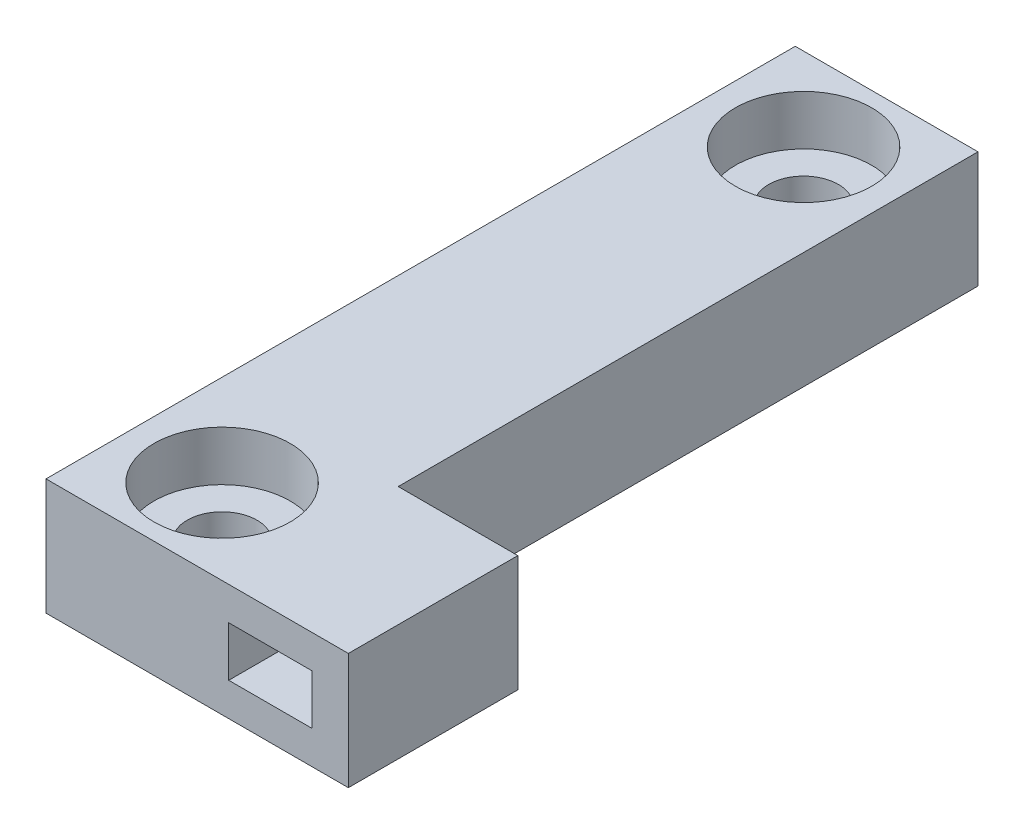
from build123d import *

# Parameters (mm, degrees)
BOSS_EXTRUDE1_DEPTH = 7
CUT_EXTRUDE1_REACH  = 51.135
SKETCH2_W           = 5
SKETCH2_H           = 3
CUT_EXTRUDE2_REACH  = 51.135
SKETCH3_R           = 2.1
SKETCH4_R           = 4.1
CUT_EXTRUDE3_DEPTH  = 3


with BuildPart() as part:
    # Sketch1 → Boss-Extrude1 (new body)
    with BuildSketch(Plane(origin=(0, 0, 0), x_dir=(1, 0, 0), z_dir=(0, 1, 0))):
        Polygon((0, 0), (18.2, 0), (18.2, 10.2), (11, 10.2), (11, 45.1), (0, 45.1), align=None)
    extrude(amount=BOSS_EXTRUDE1_DEPTH)

    # Sketch2 → Cut-Extrude1 (cut, up to next)
    with BuildSketch(Plane.XY, mode=Mode.PRIVATE) as cut_extrude1_sk1:
        with Locations((13.5, 3.5)):
            Rectangle(SKETCH2_W, SKETCH2_H)
    cut_extrude1_tool1 = extrude(cut_extrude1_sk1.sketch, amount=-CUT_EXTRUDE1_REACH, mode=Mode.PRIVATE) & part.part
    add(cut_extrude1_tool1.solids().sort_by_distance((13.5, 3.5, 0))[0], mode=Mode.SUBTRACT)

    # Sketch3 → Cut-Extrude2 (cut, up to next)
    with BuildSketch(Plane(origin=(0, 7, 0), x_dir=(1, 0, 0), z_dir=(0, 1, 0)), mode=Mode.PRIVATE) as cut_extrude2_sk1:
        with Locations((5.5, 5.1)):
            Circle(SKETCH3_R)
    cut_extrude2_tool1 = extrude(cut_extrude2_sk1.sketch, amount=-CUT_EXTRUDE2_REACH, mode=Mode.PRIVATE) & part.part
    # Sketch3 → Cut-Extrude2 (cut, up to next)
    with BuildSketch(Plane(origin=(0, 7, 0), x_dir=(1, 0, 0), z_dir=(0, 1, 0)), mode=Mode.PRIVATE) as cut_extrude2_sk2:
        with Locations((5.5, 40.1)):
            Circle(SKETCH3_R)
    cut_extrude2_tool2 = extrude(cut_extrude2_sk2.sketch, amount=-CUT_EXTRUDE2_REACH, mode=Mode.PRIVATE) & part.part
    add(cut_extrude2_tool1.solids().sort_by_distance((5.5, 7, -5.1))[0], mode=Mode.SUBTRACT)
    add(cut_extrude2_tool2.solids().sort_by_distance((5.5, 7, -40.1))[0], mode=Mode.SUBTRACT)

    # Sketch4 → Cut-Extrude3 (cut)
    with BuildSketch(Plane(origin=(0, 7, 0), x_dir=(1, 0, 0), z_dir=(0, 1, 0))):
        with Locations((5.5, 5.1)):
            Circle(SKETCH4_R)
        with Locations((5.5, 40.1)):
            Circle(SKETCH4_R)
    extrude(amount=-CUT_EXTRUDE3_DEPTH, mode=Mode.SUBTRACT)


solid = part.part
